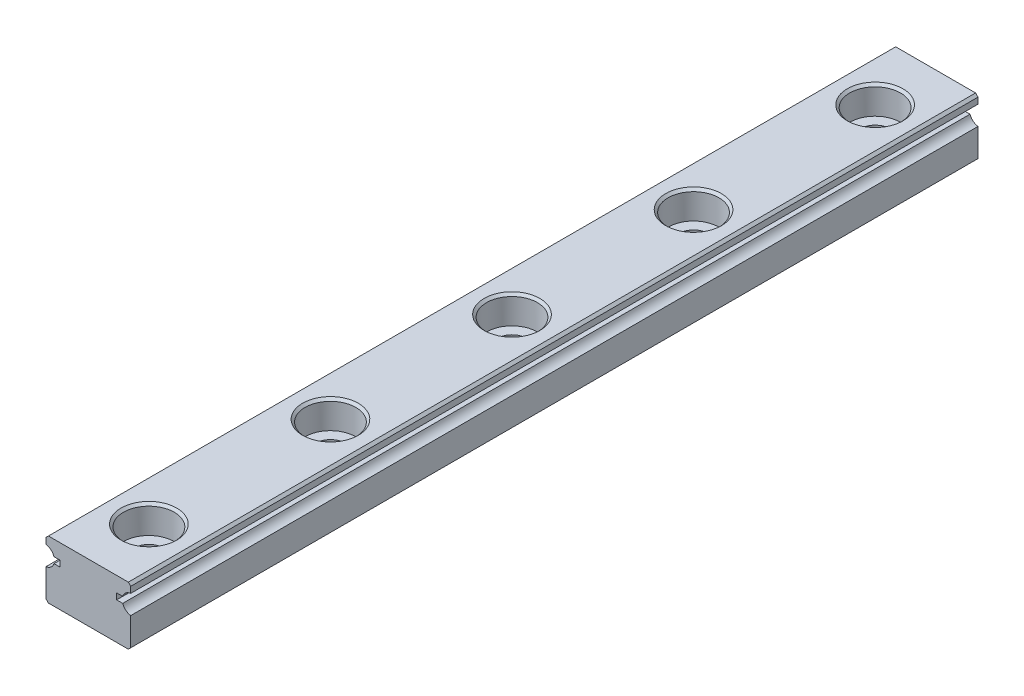
from build123d import *

# Parameters (mm, degrees)
EXTRUDE1_DEPTH             = 70
EXTRUDE2_REACH             = 72.252
SKETCH2_R                  = 1.2
SKETCH_R                   = 2.1
SKETCH_R_2                 = 1.2
EXTRUDE4_DEPTH             = 2.3
CHAMFER1_SIZE              = 0.2
LPATTERN1_COUNT            = 5
LPATTERN1_PITCH            = 15
CHAMFER1_OF_LPATTERN1_SIZE = 0.2


with BuildPart() as part:
    # Sketch1 → Extrude1 (new body)
    with BuildSketch(Plane.XY):
        with BuildLine():
            Line((-3.3, -2.4), (3.3, -2.4))
            Line((3.3, -2.4), (3.5, -2.2))
            Line((3.5, -2.2), (3.5, 0.106274607))
            ThreePointArc((3.5, 0.106274607), (3.091294745, 0.282570681), (2.840065792, 0.65))
            Line((2.840065792, 0.65), (2.340065792, 0.65))
            Line((2.340065792, 0.65), (2.340065792, 1.15))
            Line((2.340065792, 1.15), (2.840065792, 1.15))
            ThreePointArc((2.840065792, 1.15), (3.091294745, 1.517429319), (3.5, 1.693725393))
            Line((3.5, 1.693725393), (3.5, 2.2))
            Line((3.5, 2.2), (3.3, 2.4))
            Line((3.3, 2.4), (-3.3, 2.4))
            Line((-3.3, 2.4), (-3.5, 2.2))
            Line((-3.5, 2.2), (-3.5, 1.693725393))
            ThreePointArc((-3.5, 1.693725393), (-3.091294745, 1.517429319), (-2.840065792, 1.15))
            Line((-2.840065792, 1.15), (-2.340065792, 1.15))
            Line((-2.340065792, 1.15), (-2.340065792, 0.65))
            Line((-2.340065792, 0.65), (-2.840065792, 0.65))
            ThreePointArc((-2.840065792, 0.65), (-3.091294745, 0.282570681), (-3.5, 0.106274607))
            Line((-3.5, 0.106274607), (-3.5, -2.2))
            Line((-3.5, -2.2), (-3.3, -2.4))
        make_face()
    extrude(amount=EXTRUDE1_DEPTH)

    # Sketch2 → Extrude2 (cut, up to next)
    with BuildSketch(Plane(origin=(0, 2.4, 0), x_dir=(1, 0, 0), z_dir=(0, 1, 0)), mode=Mode.PRIVATE) as extrude2_sk1:
        with Locations((0, -5)):
            Circle(SKETCH2_R)
    extrude2_tool1 = extrude(extrude2_sk1.sketch, amount=-EXTRUDE2_REACH, mode=Mode.PRIVATE) & part.part
    extrude2 = extrude2_tool1.solids().sort_by_distance((0, 2.4, 5))[0]
    add(extrude2, mode=Mode.SUBTRACT)

    # Sketch → Extrude4 (cut)
    with BuildSketch(Plane(origin=(0, 2.4, 0), x_dir=(1, 0, 0), z_dir=(0, 1, 0))):
        with Locations((0, -5)):
            Circle(SKETCH_R)
        with Locations((0, -5)):
            Circle(SKETCH_R_2, mode=Mode.SUBTRACT)
    extrude4 = extrude(amount=-EXTRUDE4_DEPTH, mode=Mode.SUBTRACT)

    # Chamfer1
    chamfer1_edges = [part.edges().sort_by_distance(p)[0] for p in [
        (-1.2, -2.4, 5),
        (-2.1, 2.4, 5),
    ]]
    chamfer(chamfer1_edges, length=CHAMFER1_SIZE)

    # LPattern1: Extrude2, Extrude4 ×5
    with Locations(*[(0, 0, i * LPATTERN1_PITCH) for i in range(1, LPATTERN1_COUNT)]):
        add(extrude2, mode=Mode.SUBTRACT)
        add(extrude4, mode=Mode.SUBTRACT)

    # Chamfer1 of LPattern1
    chamfer1_of_lpattern1_edges = [part.edges().sort_by_distance(p)[0] for p in [
        (-1.2, -2.4, 20),
        (-2.1, 2.4, 20),
        (-1.2, -2.4, 35),
        (-2.1, 2.4, 35),
        (-1.2, -2.4, 50),
        (-2.1, 2.4, 50),
        (-1.2, -2.4, 65),
        (-2.1, 2.4, 65),
    ]]
    chamfer(chamfer1_of_lpattern1_edges, length=CHAMFER1_OF_LPATTERN1_SIZE)


solid = part.part
